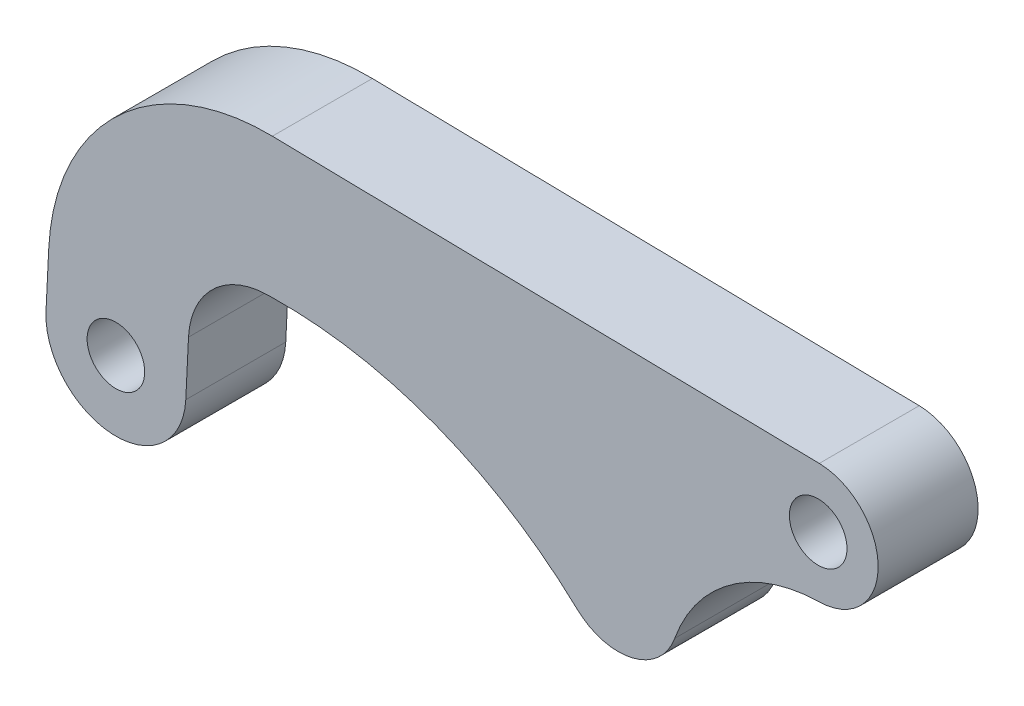
from build123d import *

# Parameters (mm, degrees)
SKETCH1_R           = 2.286
BOSS_EXTRUDE1_DEPTH = 3.96875


with BuildPart() as part:
    # Sketch1 → Boss-Extrude1 (new, symmetric)
    with BuildSketch(Plane.XY):
        with BuildLine():
            Line((55.852160303, 20.499543888), (12.426339018, 21.289226167))
            ThreePointArc((12.426339018, 21.289226167), (0.183355577, 16.585853064), (-5.332604413, 4.686838505))
            Line((-5.332604413, 4.686838505), (-5.549551288, 0.272753664))
            ThreePointArc((-5.549551288, 0.272753664), (-0.272753664, -5.549551288), (5.549551288, -0.272753664))
            Line((5.549551288, -0.272753664), (5.766498164, 4.141331178))
            ThreePointArc((5.766498164, 4.141331178), (7.688680768, 8.388633469), (11.993389211, 10.178563055))
            Line((11.993389211, 10.178563055), (12.426339018, 10.186436085))
            ThreePointArc((12.426339018, 10.186436085), (25.439943967, 7.888709862), (36.631753623, 0.861843123))
            ThreePointArc((36.631753623, 0.861843123), (41.008806893, -0.294544749), (44.375376773, 2.732340695))
            ThreePointArc((44.375376773, 2.732340695), (48.828052243, 8.644171979), (55.852160303, 10.976118364))
            ThreePointArc((55.852160303, 10.976118364), (60.528070342, 15.737831126), (55.852160303, 20.499543888))
        make_face()
        Circle(SKETCH1_R, mode=Mode.SUBTRACT)
        with Locations((55.765570342, 15.737831126)):
            Circle(SKETCH1_R, mode=Mode.SUBTRACT)
    extrude(amount=BOSS_EXTRUDE1_DEPTH, both=True)


solid = part.part
